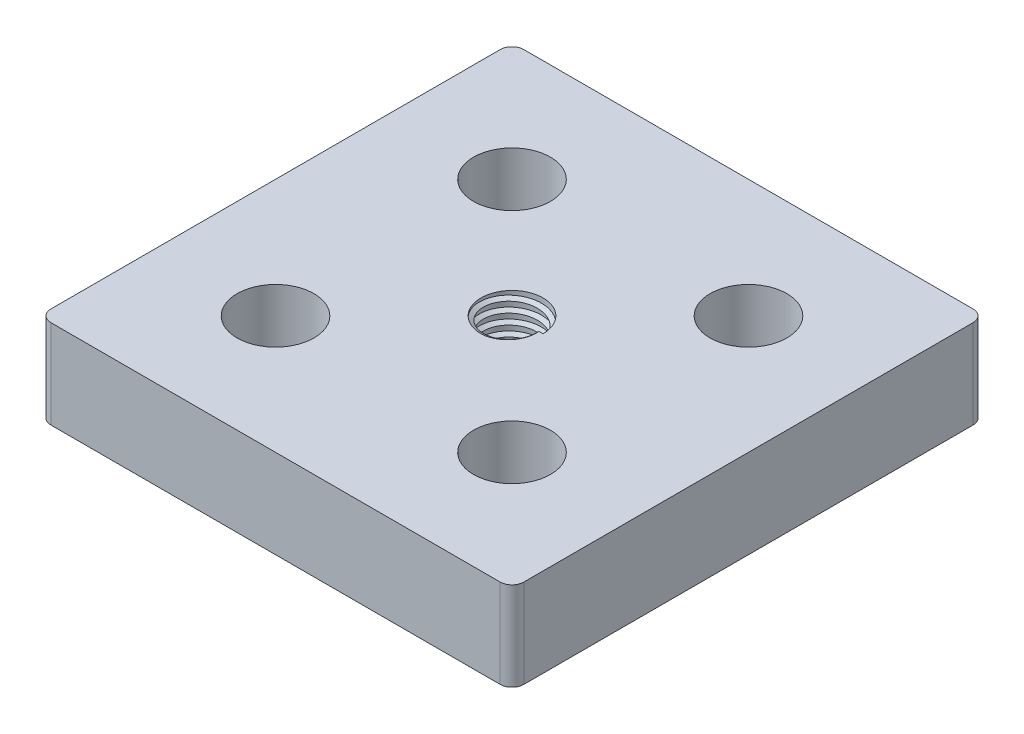
from build123d import *

# Parameters (mm, degrees)
SKETCH_1_R          = 4.5
SKETCH_1_R_2        = 5.25
EXTRUDE_1_DEPTH     = 15
SKETCH_3_R          = 6.5
CUT_EXTRUDE_1_DEPTH = 10
SWEEP_1_PITCH       = 1.75
SKETCH_6_W          = 83.618980237
SKETCH_6_H          = 10.399921
SKETCH_6_W_2        = 81.909889018
SKETCH_6_H_2        = 15.246726682
CUT_EXTRUDE_2_DEPTH = 91.792592337


with BuildPart() as part:
    # 草图1 → 凸台-拉伸1 (new body)
    with BuildSketch(Plane(origin=(0, 0, 0), x_dir=(1, 0, 0), z_dir=(0, 1, 0))):
        with BuildLine():
            Line((-38, -40), (38, -40))
            ThreePointArc((38, -40), (39.414213562, -39.414213562), (40, -38))
            Line((40, -38), (40, 38))
            ThreePointArc((40, 38), (39.414213562, 39.414213562), (38, 40))
            Line((38, 40), (-38, 40))
            ThreePointArc((-38, 40), (-39.414213562, 39.414213562), (-40, 38))
            Line((-40, 38), (-40, -38))
            ThreePointArc((-40, -38), (-39.414213562, -39.414213562), (-38, -40))
        make_face()
        with Locations(Location((-20, 20, 0), (0, 0, 270))):
            Circle(SKETCH_1_R, mode=Mode.SUBTRACT)
        with Locations(Location((-20, -20, 0), (0, 0, 270))):
            Circle(SKETCH_1_R, mode=Mode.SUBTRACT)
        with Locations(Location((20, -20, 0), (0, 0, 270))):
            Circle(SKETCH_1_R, mode=Mode.SUBTRACT)
        with Locations(Location((20, 20, 0), (0, 0, 270))):
            Circle(SKETCH_1_R, mode=Mode.SUBTRACT)
        with Locations(Location((0, 0, 0), (0, 0, 270))):
            Circle(SKETCH_1_R_2, mode=Mode.SUBTRACT)
    extrude(amount=EXTRUDE_1_DEPTH)

    # 草图3 → 切除-拉伸1 (cut)
    with BuildSketch(Plane(origin=(0, 15, 0), x_dir=(1, 0, 0), z_dir=(0, 1, 0))):
        with Locations(Location((-20, 20, 0), (0, 0, 270))):
            Circle(SKETCH_3_R)
        with Locations(Location((20, 20, 0), (0, 0, 270))):
            Circle(SKETCH_3_R)
        with Locations(Location((20, -20, 0), (0, 0, 270))):
            Circle(SKETCH_3_R)
        with Locations(Location((-20, -20, 0), (0, 0, 270))):
            Circle(SKETCH_3_R)
    extrude(amount=-CUT_EXTRUDE_1_DEPTH, mode=Mode.SUBTRACT)

    # 扫描1: the profile of 草图5 screwed along a right-hand helix of 8.571429 turns, 10 arcs to a turn; built about Z, then put on its axis
    sweep_1_z = Axis((0, 0, 0), (0, 0, 1))
    sweep_1_corners = [(4.558622126, 0, 0), (5.595688937, -0.03172011, 0.597909992), (5.595688937, 0.03172011, -0.597909992)]
    with BuildLine(mode=Mode.PRIVATE) as sweep_1_profile:
        Line(sweep_1_corners[0], sweep_1_corners[1])
        Line(sweep_1_corners[1], sweep_1_corners[2])
        Line(sweep_1_corners[2], sweep_1_corners[0])
    sweep_1_cap = Face(sweep_1_profile.wire())
    sweep_1_turn_angles = [0, 18, 36, 54, 72, 90, 108, 126, 144, 162, 180, 198, 216, 234, 252, 270, 288, 306, 324, 342, 360]
    sweep_1_turn_weights = [1, 0.9510565162951535, 1, 0.9510565162951535, 1, 0.9510565162951535, 1, 0.9510565162951535, 1, 0.9510565162951535, 1, 0.9510565162951535, 1, 0.9510565162951535, 1, 0.9510565162951535, 1, 0.9510565162951535, 1, 0.9510565162951535, 1]
    sweep_1_turn_rails = [Edge.make_bspline([Vector(p[0], p[1], 0).rotate(sweep_1_z, sweep_1_turn_angles[k]) / sweep_1_turn_weights[k] + Vector(0, 0, p[2] + SWEEP_1_PITCH * sweep_1_turn_angles[k] / 360) for k in range(21)], [0, 0, 0, 1, 1, 2, 2, 3, 3, 4, 4, 5, 5, 6, 6, 7, 7, 8, 8, 9, 9, 10, 10, 10], 2, sweep_1_turn_weights) for p in sweep_1_corners]
    sweep_1_turn_sides = [Face.make_surface_from_curves(sweep_1_turn_rails[p[0]], sweep_1_turn_rails[p[1]]) for p in [(0, 1), (1, 2), (2, 0)]]
    sweep_1_last_angles = [2880, 2898, 2916, 2934, 2952, 2970, 2988, 3006, 3024, 3042, 3060, 3072.857142857, 3085.714285714]
    sweep_1_last_weights = [1, 0.9510565162951535, 1, 0.9510565162951535, 1, 0.9510565162951535, 1, 0.9510565162951535, 1, 0.9510565162951535, 1, 0.9749279121818305, 1]
    sweep_1_last_rails = [Edge.make_bspline([Vector(p[0], p[1], 0).rotate(sweep_1_z, sweep_1_last_angles[k]) / sweep_1_last_weights[k] + Vector(0, 0, p[2] + SWEEP_1_PITCH * sweep_1_last_angles[k] / 360) for k in range(13)], [0, 0, 0, 1, 1, 2, 2, 3, 3, 4, 4, 5, 5, 6, 6, 6], 2, sweep_1_last_weights) for p in sweep_1_corners]
    sweep_1_last_sides = [Face.make_surface_from_curves(sweep_1_last_rails[p[0]], sweep_1_last_rails[p[1]]) for p in [(0, 1), (1, 2), (2, 0)]]
    sweep_1 = Plane(origin=(0, 15, 0), x_dir=(1, 0, 0), z_dir=(0, -1, 0)) * Solid(Shell([*[p.moved(Location((0, 0, SWEEP_1_PITCH * i))) for i in range(8) for p in sweep_1_turn_sides], *sweep_1_last_sides, sweep_1_cap, sweep_1_cap.rotate(sweep_1_z, 3085.714285714).moved(Location((0, 0, SWEEP_1_PITCH * 3085.714285714 / 360)))]))
    add(sweep_1)

    # 草图6 → 切除-拉伸2 (cut, through all)
    with BuildSketch(Plane.ZY.offset(40)):
        with Locations((1.809490119, 20.1999605)):
            Rectangle(SKETCH_6_W, SKETCH_6_H)
        with Locations((0.954944509, -7.623363341)):
            Rectangle(SKETCH_6_W_2, SKETCH_6_H_2)
    extrude(amount=-CUT_EXTRUDE_2_DEPTH, mode=Mode.SUBTRACT)


solid = part.part
